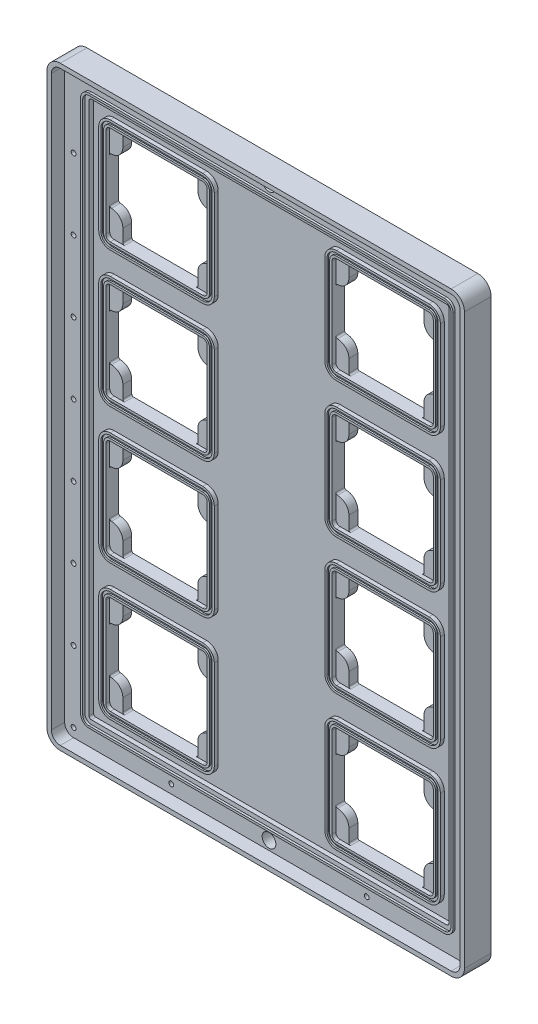
from build123d import *

# Parameters (mm, degrees)
SKETCH1_W            = 292.1
SKETCH1_H            = 419.1
BOSS_EXTRUDE1_DEPTH  = 9.525
SKETCH4_R            = 1.7272
CUT_EXTRUDE1_DEPTH   = 6.985
LPATTERN2_COUNT      = 8
LPATTERN2_PITCH      = 50.8
LPATTERN3_COUNT      = 4
LPATTERN3_PITCH      = 69.85
CUT_EXTRUDE3_DEPTH   = 3.175
BOSS_EXTRUDE2_DEPTH  = 1.5875
SKETCH7_R            = 4.9022
CUT_EXTRUDE4_DEPTH   = 511.938299235
FILLET1_R            = 6.35
CUT_EXTRUDE5_DEPTH   = 3.175
CUT_EXTRUDE6_DEPTH   = 511.970358882
SKETCH11_R           = 1.1303
CUT_EXTRUDE7_DEPTH   = 3.96875
BOSS_EXTRUDE3_DEPTH  = 2.794
BOSS_EXTRUDE4_DEPTH  = 1.651
LPATTERN1_COUNT      = 2
LPATTERN1_PITCH      = 161.5948
LPATTERN1_COUNT_DIR2 = 4
LPATTERN1_PITCH_DIR2 = 96.8756
BOSS_EXTRUDE5_START  = -19.05
BOSS_EXTRUDE5_DEPTH  = 19.05


with BuildPart() as part:
    # Sketch1 → Boss-Extrude1 (new body)
    with BuildSketch(Plane.XY):
        with Locations((146.05, 209.55)):
            Rectangle(SKETCH1_W, SKETCH1_H)
    extrude(amount=BOSS_EXTRUDE1_DEPTH)

    # Sketch4 → Cut-Extrude1 (cut)
    with BuildSketch(Plane.XY.offset(9.525)):
        with Locations((6.35, 6.35)):
            Circle(SKETCH4_R)
        with Locations((6.35, 412.75)):
            Circle(SKETCH4_R)
        with Locations((285.75, 412.75)):
            Circle(SKETCH4_R)
        with Locations((285.75, 6.35)):
            Circle(SKETCH4_R)
    cut_extrude1 = extrude(amount=-CUT_EXTRUDE1_DEPTH, mode=Mode.SUBTRACT)

    # LPattern2: Cut-Extrude1 ×8
    with Locations(*[(0, -i * LPATTERN2_PITCH, 0) for i in range(1, LPATTERN2_COUNT)]):
        add(cut_extrude1, mode=Mode.SUBTRACT)

    # LPattern3: Cut-Extrude1 ×4
    with Locations(*[(-i * LPATTERN3_PITCH, 0, 0) for i in range(1, LPATTERN3_COUNT)]):
        add(cut_extrude1, mode=Mode.SUBTRACT)

    # Sketch6 → Cut-Extrude3 (cut)
    with BuildSketch(Plane.XY.offset(9.525)):
        with BuildLine():
            Line((273.05, 401.6375), (19.05, 401.6375))
            ThreePointArc((19.05, 401.6375), (17.927467985, 401.172532015), (17.4625, 400.05))
            Line((17.4625, 400.05), (17.4625, 19.05))
            ThreePointArc((17.4625, 19.05), (17.927467985, 17.927467985), (19.05, 17.4625))
            Line((19.05, 17.4625), (273.05, 17.4625))
            ThreePointArc((273.05, 17.4625), (274.172532015, 17.927467985), (274.6375, 19.05))
            Line((274.6375, 19.05), (274.6375, 400.05))
            ThreePointArc((274.6375, 400.05), (274.172532015, 401.172532015), (273.05, 401.6375))
        make_face()
    extrude(amount=-CUT_EXTRUDE3_DEPTH, mode=Mode.SUBTRACT)

    # Sketch5 → Boss-Extrude2 (add)
    with BuildSketch(Plane.XY.offset(9.525)):
        with BuildLine():
            ThreePointArc((19.05, 406.146), (14.739477062, 404.360522938), (12.954, 400.05))
            Line((12.954, 400.05), (12.954, 19.05))
            ThreePointArc((12.954, 19.05), (14.739477062, 14.739477062), (19.05, 12.954))
            Line((19.05, 12.954), (273.05, 12.954))
            ThreePointArc((273.05, 12.954), (277.360522938, 14.739477062), (279.146, 19.05))
            Line((279.146, 19.05), (279.146, 400.05))
            ThreePointArc((279.146, 400.05), (277.360522938, 404.360522938), (273.05, 406.146))
            Line((273.05, 406.146), (19.05, 406.146))
        make_face()
        with BuildLine():
            ThreePointArc((273.05, 404.622), (276.282892204, 403.282892204), (277.622, 400.05))
            Line((277.622, 400.05), (277.622, 19.05))
            ThreePointArc((277.622, 19.05), (276.282892204, 15.817107796), (273.05, 14.478))
            Line((273.05, 14.478), (19.05, 14.478))
            ThreePointArc((19.05, 14.478), (15.817107796, 15.817107796), (14.478, 19.05))
            Line((14.478, 19.05), (14.478, 400.05))
            ThreePointArc((14.478, 400.05), (15.817107796, 403.282892204), (19.05, 404.622))
            Line((19.05, 404.622), (273.05, 404.622))
        make_face(mode=Mode.SUBTRACT)
    extrude(amount=BOSS_EXTRUDE2_DEPTH)

    # Sketch7 → Cut-Extrude4 (cut, through all)
    with BuildSketch(Plane.XY.offset(9.525)):
        with Locations((146.05, 6.35)):
            Circle(SKETCH7_R)
        with Locations((146.05, 412.75)):
            Circle(SKETCH7_R)
    extrude(amount=-CUT_EXTRUDE4_DEPTH, mode=Mode.SUBTRACT)

    # Fillet1
    fillet1_edges = [part.edges().sort_by_distance(p)[0] for p in [
        (0, 419.1, 4.7625),
        (292.1, 419.1, 4.7625),
        (0, 0, 4.7625),
        (292.1, 0, 4.7625),
    ]]
    fillet(fillet1_edges, radius=FILLET1_R)

    # Sketch8 → Cut-Extrude5 (cut)
    with BuildSketch(Plane(origin=(0, 0, 0), x_dir=(-1, 0, 0), z_dir=(0, 0, -1))):
        with BuildLine():
            Line((-201.2442, 393.7), (-252.4506, 393.7))
            ThreePointArc((-252.4506, 393.7), (-255.881057838, 392.279057838), (-257.302, 388.8486))
            Line((-257.302, 388.8486), (-257.302, 379.857))
            ThreePointArc((-257.302, 379.857), (-258.633668309, 376.642068309), (-261.8486, 375.3104))
            ThreePointArc((-261.8486, 375.3104), (-265.279057838, 373.889457838), (-266.7, 370.459))
            Line((-266.7, 370.459), (-266.7, 339.2678))
            ThreePointArc((-266.7, 339.2678), (-265.279057838, 335.837342162), (-261.8486, 334.4164))
            ThreePointArc((-261.8486, 334.4164), (-258.633668309, 333.084731691), (-257.302, 329.8698))
            Line((-257.302, 329.8698), (-257.302, 320.8782))
            ThreePointArc((-257.302, 320.8782), (-255.881057838, 317.447742162), (-252.4506, 316.0268))
            Line((-252.4506, 316.0268), (-201.2442, 316.0268))
            ThreePointArc((-201.2442, 316.0268), (-197.813742162, 317.447742162), (-196.3928, 320.8782))
            Line((-196.3928, 320.8782), (-196.3928, 329.8698))
            ThreePointArc((-196.3928, 329.8698), (-195.061131691, 333.084731691), (-191.8462, 334.4164))
            ThreePointArc((-191.8462, 334.4164), (-188.415742162, 335.837342162), (-186.9948, 339.2678))
            Line((-186.9948, 339.2678), (-186.9948, 370.459))
            ThreePointArc((-186.9948, 370.459), (-188.415742162, 373.889457838), (-191.8462, 375.3104))
            ThreePointArc((-191.8462, 375.3104), (-195.061131691, 376.642068309), (-196.3928, 379.857))
            Line((-196.3928, 379.857), (-196.3928, 388.8486))
            ThreePointArc((-196.3928, 388.8486), (-197.813742162, 392.279057838), (-201.2442, 393.7))
        make_face()
        with BuildLine():
            Line((-264.668, 370.459), (-264.668, 339.2678))
            ThreePointArc((-264.668, 339.2678), (-263.842216859, 337.274183141), (-261.8486, 336.4484))
            ThreePointArc((-261.8486, 336.4484), (-257.196827329, 334.521572671), (-255.27, 329.8698))
            Line((-255.27, 329.8698), (-255.27, 320.8782))
            ThreePointArc((-255.27, 320.8782), (-254.444216859, 318.884583141), (-252.4506, 318.0588))
            Line((-252.4506, 318.0588), (-201.2442, 318.0588))
            ThreePointArc((-201.2442, 318.0588), (-199.250583141, 318.884583141), (-198.4248, 320.8782))
            Line((-198.4248, 320.8782), (-198.4248, 329.8698))
            ThreePointArc((-198.4248, 329.8698), (-196.497972671, 334.521572671), (-191.8462, 336.4484))
            ThreePointArc((-191.8462, 336.4484), (-189.852583141, 337.274183141), (-189.0268, 339.2678))
            Line((-189.0268, 339.2678), (-189.0268, 370.459))
            ThreePointArc((-189.0268, 370.459), (-189.852583141, 372.452616859), (-191.8462, 373.2784))
            ThreePointArc((-191.8462, 373.2784), (-196.497972671, 375.205227329), (-198.4248, 379.857))
            Line((-198.4248, 379.857), (-198.4248, 388.8486))
            ThreePointArc((-198.4248, 388.8486), (-199.250583141, 390.842216859), (-201.2442, 391.668))
            Line((-201.2442, 391.668), (-252.4506, 391.668))
            ThreePointArc((-252.4506, 391.668), (-254.444216859, 390.842216859), (-255.27, 388.8486))
            Line((-255.27, 388.8486), (-255.27, 379.857))
            ThreePointArc((-255.27, 379.857), (-257.196827329, 375.205227329), (-261.8486, 373.2784))
            ThreePointArc((-261.8486, 373.2784), (-263.842216859, 372.452616859), (-264.668, 370.459))
        make_face(mode=Mode.SUBTRACT)
    cut_extrude5 = extrude(amount=-CUT_EXTRUDE5_DEPTH, mode=Mode.SUBTRACT)

    # Sketch10 → Cut-Extrude6 (cut, through all)
    with BuildSketch(Plane(origin=(0, 0, 0), x_dir=(-1, 0, 0), z_dir=(0, 0, -1))):
        with BuildLine():
            Line((-263.0805, 370.459), (-263.0805, 339.2678))
            ThreePointArc((-263.0805, 339.2678), (-262.719684844, 338.396715156), (-261.8486, 338.0359))
            ThreePointArc((-261.8486, 338.0359), (-256.074295314, 335.644104686), (-253.6825, 329.8698))
            Line((-253.6825, 329.8698), (-253.6825, 320.8782))
            ThreePointArc((-253.6825, 320.8782), (-253.321684844, 320.007115156), (-252.4506, 319.6463))
            Line((-252.4506, 319.6463), (-201.2442, 319.6463))
            ThreePointArc((-201.2442, 319.6463), (-200.373115156, 320.007115156), (-200.0123, 320.8782))
            Line((-200.0123, 320.8782), (-200.0123, 329.8698))
            ThreePointArc((-200.0123, 329.8698), (-197.620504686, 335.644104686), (-191.8462, 338.0359))
            ThreePointArc((-191.8462, 338.0359), (-190.975115156, 338.396715156), (-190.6143, 339.2678))
            Line((-190.6143, 339.2678), (-190.6143, 370.459))
            ThreePointArc((-190.6143, 370.459), (-190.975115156, 371.330084844), (-191.8462, 371.6909))
            ThreePointArc((-191.8462, 371.6909), (-197.620504686, 374.082695314), (-200.0123, 379.857))
            Line((-200.0123, 379.857), (-200.0123, 388.8486))
            ThreePointArc((-200.0123, 388.8486), (-200.373115156, 389.719684844), (-201.2442, 390.0805))
            Line((-201.2442, 390.0805), (-252.4506, 390.0805))
            ThreePointArc((-252.4506, 390.0805), (-253.321684844, 389.719684844), (-253.6825, 388.8486))
            Line((-253.6825, 388.8486), (-253.6825, 379.857))
            ThreePointArc((-253.6825, 379.857), (-256.074295314, 374.082695314), (-261.8486, 371.6909))
            ThreePointArc((-261.8486, 371.6909), (-262.719684844, 371.330084844), (-263.0805, 370.459))
        make_face()
    cut_extrude6 = extrude(amount=-CUT_EXTRUDE6_DEPTH, mode=Mode.SUBTRACT)

    # Sketch11 → Cut-Extrude7 (cut)
    with BuildSketch(Plane(origin=(0, 0, 0), x_dir=(-1, 0, 0), z_dir=(0, 0, -1))):
        with Locations((-261.8486, 388.8994)):
            Circle(SKETCH11_R)
        with Locations((-191.8462, 388.8994)):
            Circle(SKETCH11_R)
        with Locations((-191.8462, 320.8274)):
            Circle(SKETCH11_R)
        with Locations((-261.8486, 320.8274)):
            Circle(SKETCH11_R)
    cut_extrude7 = extrude(amount=-CUT_EXTRUDE7_DEPTH, mode=Mode.SUBTRACT)

    # Sketch12 → Boss-Extrude3 (add)
    # profile 1 of 2: a face of its own
    with BuildSketch(Plane.XY.offset(6.35)):
        with BuildLine():
            ThreePointArc((193.7893, 395.1605), (187.952133521, 392.742666479), (185.5343, 386.9055))
            Line((185.5343, 386.9055), (185.5343, 322.8213))
            ThreePointArc((185.5343, 322.8213), (187.952133521, 316.984133521), (193.7893, 314.5663))
            Line((193.7893, 314.5663), (259.9055, 314.5663))
            ThreePointArc((259.9055, 314.5663), (265.742666479, 316.984133521), (268.1605, 322.8213))
            Line((268.1605, 322.8213), (268.1605, 386.9055))
            ThreePointArc((268.1605, 386.9055), (265.742666479, 392.742666479), (259.9055, 395.1605))
            Line((259.9055, 395.1605), (193.7893, 395.1605))
        make_face()
        with BuildLine():
            Line((187.1218, 322.8213), (187.1218, 386.9055))
            ThreePointArc((187.1218, 386.9055), (189.074665536, 391.620134464), (193.7893, 393.573))
            Line((193.7893, 393.573), (259.9055, 393.573))
            ThreePointArc((259.9055, 393.573), (264.620134464, 391.620134464), (266.573, 386.9055))
            Line((266.573, 386.9055), (266.573, 322.8213))
            ThreePointArc((266.573, 322.8213), (264.620134464, 318.106665536), (259.9055, 316.1538))
            Line((259.9055, 316.1538), (193.7893, 316.1538))
            ThreePointArc((193.7893, 316.1538), (189.074665536, 318.106665536), (187.1218, 322.8213))
        make_face(mode=Mode.SUBTRACT)
    # profile 2 of 2: a face of its own
    with BuildSketch(Plane.XY.offset(6.35)):
        with BuildLine():
            Line((259.9055, 391.668), (193.7893, 391.668))
            ThreePointArc((193.7893, 391.668), (190.421703955, 390.273096045), (189.0268, 386.9055))
            Line((189.0268, 386.9055), (189.0268, 322.8213))
            ThreePointArc((189.0268, 322.8213), (190.421703955, 319.453703955), (193.7893, 318.0588))
            Line((193.7893, 318.0588), (259.9055, 318.0588))
            ThreePointArc((259.9055, 318.0588), (263.273096045, 319.453703955), (264.668, 322.8213))
            Line((264.668, 322.8213), (264.668, 386.9055))
            ThreePointArc((264.668, 386.9055), (263.273096045, 390.273096045), (259.9055, 391.668))
        make_face()
        with BuildLine():
            ThreePointArc((190.6143, 386.9055), (191.54423597, 389.15056403), (193.7893, 390.0805))
            Line((193.7893, 390.0805), (259.9055, 390.0805))
            ThreePointArc((259.9055, 390.0805), (262.15056403, 389.15056403), (263.0805, 386.9055))
            Line((263.0805, 386.9055), (263.0805, 322.8213))
            ThreePointArc((263.0805, 322.8213), (262.15056403, 320.57623597), (259.9055, 319.6463))
            Line((259.9055, 319.6463), (193.7893, 319.6463))
            ThreePointArc((193.7893, 319.6463), (191.54423597, 320.57623597), (190.6143, 322.8213))
            Line((190.6143, 322.8213), (190.6143, 386.9055))
        make_face(mode=Mode.SUBTRACT)
    boss_extrude3 = extrude(amount=BOSS_EXTRUDE3_DEPTH)

    # Sketch12<3> → Boss-Extrude4 (add)
    with BuildSketch(Plane.XY.offset(6.35)):
        with BuildLine():
            ThreePointArc((193.7893, 393.573), (189.074665536, 391.620134464), (187.1218, 386.9055))
            Line((187.1218, 386.9055), (187.1218, 322.8213))
            ThreePointArc((187.1218, 322.8213), (189.074665536, 318.106665536), (193.7893, 316.1538))
            Line((193.7893, 316.1538), (259.9055, 316.1538))
            ThreePointArc((259.9055, 316.1538), (264.620134464, 318.106665536), (266.573, 322.8213))
            Line((266.573, 322.8213), (266.573, 386.9055))
            ThreePointArc((266.573, 386.9055), (264.620134464, 391.620134464), (259.9055, 393.573))
            Line((259.9055, 393.573), (193.7893, 393.573))
        make_face()
        with BuildLine():
            ThreePointArc((189.0268, 386.9055), (190.421703955, 390.273096045), (193.7893, 391.668))
            Line((193.7893, 391.668), (259.9055, 391.668))
            ThreePointArc((259.9055, 391.668), (263.273096045, 390.273096045), (264.668, 386.9055))
            Line((264.668, 386.9055), (264.668, 322.8213))
            ThreePointArc((264.668, 322.8213), (263.273096045, 319.453703955), (259.9055, 318.0588))
            Line((259.9055, 318.0588), (193.7893, 318.0588))
            ThreePointArc((193.7893, 318.0588), (190.421703955, 319.453703955), (189.0268, 322.8213))
            Line((189.0268, 322.8213), (189.0268, 386.9055))
        make_face(mode=Mode.SUBTRACT)
    boss_extrude4 = extrude(amount=BOSS_EXTRUDE4_DEPTH)

    # LPattern1: Cut-Extrude5, Cut-Extrude6, Cut-Extrude7, Boss-Extrude3, Boss-Extrude4 2 × 4
    with Locations(*[(-i * LPATTERN1_PITCH, -j * LPATTERN1_PITCH_DIR2, 0) for i in range(LPATTERN1_COUNT) for j in range(LPATTERN1_COUNT_DIR2) if (i, j) != (0, 0)]):
        add(cut_extrude5, mode=Mode.SUBTRACT)
        add(cut_extrude6, mode=Mode.SUBTRACT)
        add(cut_extrude7, mode=Mode.SUBTRACT)
        add(boss_extrude3)
        add(boss_extrude4)

    # Sketch13 → Boss-Extrude5 (add)
    with BuildSketch(Plane(origin=(0, 0, 0), x_dir=(-1, 0, 0), z_dir=(0, 0, -1)).offset(BOSS_EXTRUDE5_START)):
        with BuildLine():
            Line((-285.75, -3.175), (-6.35, -3.175))
            ThreePointArc((-6.35, -3.175), (0.385192091, -0.385192091), (3.175, 6.35))
            Line((3.175, 6.35), (3.175, 412.75))
            ThreePointArc((3.175, 412.75), (0.385192091, 419.485192091), (-6.35, 422.275))
            Line((-6.35, 422.275), (-285.75, 422.275))
            ThreePointArc((-285.75, 422.275), (-292.485192091, 419.485192091), (-295.275, 412.75))
            Line((-295.275, 412.75), (-295.275, 6.35))
            ThreePointArc((-295.275, 6.35), (-292.485192091, -0.385192091), (-285.75, -3.175))
        make_face()
        with BuildLine():
            Line((-6.35, 419.1), (-285.75, 419.1))
            ThreePointArc((-285.75, 419.1), (-290.240128061, 417.240128061), (-292.1, 412.75))
            Line((-292.1, 412.75), (-292.1, 6.35))
            ThreePointArc((-292.1, 6.35), (-290.240128061, 1.859871939), (-285.75, 0))
            Line((-285.75, 0), (-6.35, 0))
            ThreePointArc((-6.35, 0), (-1.859871939, 1.859871939), (0, 6.35))
            Line((0, 6.35), (0, 412.75))
            ThreePointArc((0, 412.75), (-1.859871939, 417.240128061), (-6.35, 419.1))
        make_face(mode=Mode.SUBTRACT)
    extrude(amount=BOSS_EXTRUDE5_DEPTH)


solid = part.part
